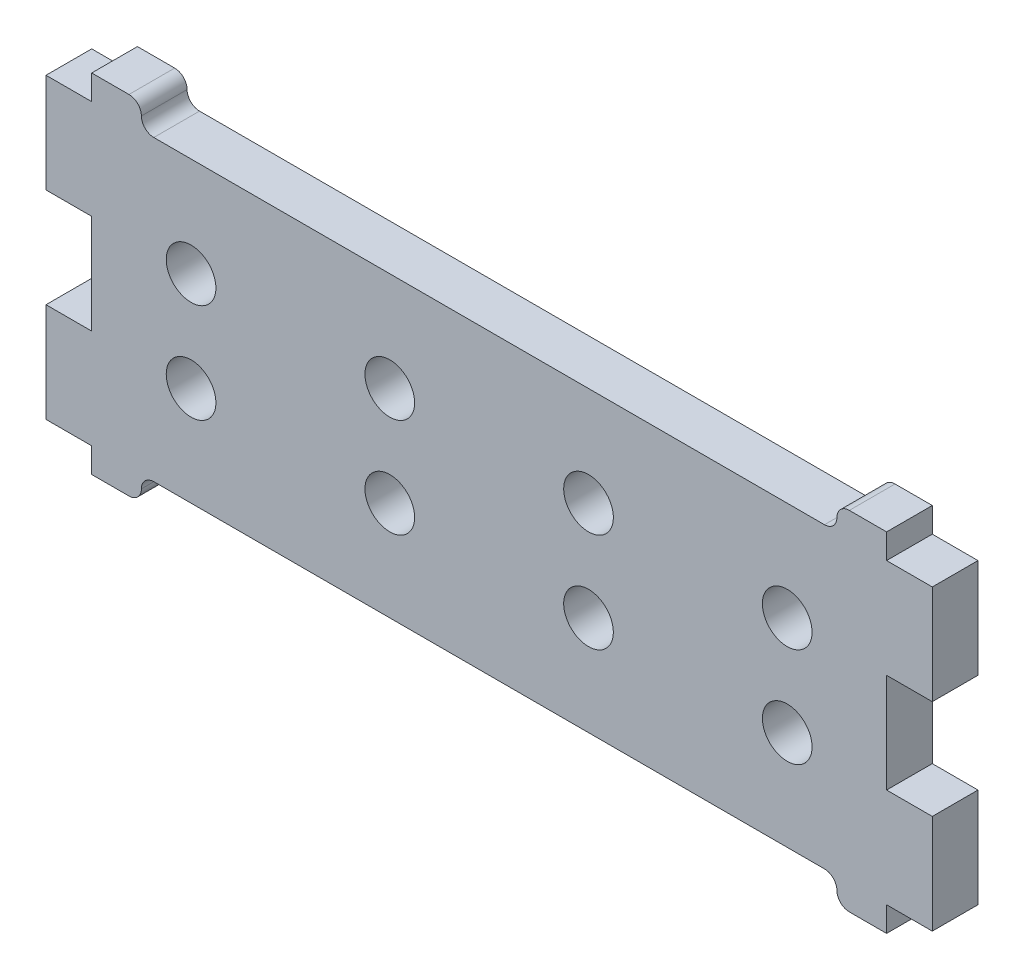
from build123d import *

# Parameters (mm, degrees)
BOSS_EXTRUDE1_DEPTH = 5.842
FILLET1_R           = 1.5875
SKETCH2_R           = 3.175
CUT_EXTRUDE1_DEPTH  = 62.126064432


with BuildPart() as part:
    # Sketch1 → Boss-Extrude1 (new body)
    with BuildSketch(Plane.XY):
        Polygon((50.8, -22.225), (44.45, -22.225), (44.45, -19.05), (-44.45, -19.05), (-44.45, -22.225), (-50.8, -22.225), (-50.8, -19.05), (-56.642, -19.05), (-56.642, -6.35), (-50.8, -6.35), (-50.8, 6.35), (-56.642, 6.35), (-56.642, 19.05), (-50.8, 19.05), (-50.8, 22.225), (-44.45, 22.225), (-44.45, 19.05), (44.45, 19.05), (44.45, 22.225), (50.8, 22.225), (50.8, 19.05), (56.642, 19.05), (56.642, 6.35), (50.8, 6.35), (50.8, -6.35), (56.642, -6.35), (56.642, -19.05), (50.8, -19.05), align=None)
    extrude(amount=BOSS_EXTRUDE1_DEPTH)

    # Fillet1
    fillet1_edges = [part.edges().sort_by_distance(p)[0] for p in [
        (-44.45, -19.05, 2.921),
        (44.45, -19.05, 2.921),
        (44.45, 19.05, 2.921),
        (-44.45, 19.05, 2.921),
    ]]
    fillet(fillet1_edges, radius=FILLET1_R)
    fillet1_2_edges = [part.edges().sort_by_distance(p)[0] for p in [
        (-44.45, -22.225, 2.921),
        (44.45, -22.225, 2.921),
        (44.45, 22.225, 2.921),
        (-44.45, 22.225, 2.921),
    ]]
    fillet(fillet1_2_edges, radius=FILLET1_R - 0.0001)  # a hair under: the kernel refuses the full size

    # Sketch2 → Cut-Extrude1 (cut, through all)
    with BuildSketch(Plane.XY.offset(5.842)):
        with Locations((-38.1, 6.35)):
            Circle(SKETCH2_R)
        with Locations((-12.7, 6.35)):
            Circle(SKETCH2_R)
        with Locations(Location((-12.7, -6.35, 0), (0, 0, 180))):
            Circle(SKETCH2_R)
        with Locations(Location((-38.1, -6.35, 0), (0, 0, 180))):
            Circle(SKETCH2_R)
        with Locations((38.1, -6.35)):
            Circle(SKETCH2_R)
        with Locations((12.7, -6.35)):
            Circle(SKETCH2_R)
        with Locations(Location((12.7, 6.35, 0), (0, 0, 180))):
            Circle(SKETCH2_R)
        with Locations(Location((38.1, 6.35, 0), (0, 0, 180))):
            Circle(SKETCH2_R)
    extrude(amount=-CUT_EXTRUDE1_DEPTH, mode=Mode.SUBTRACT)


solid = part.part
